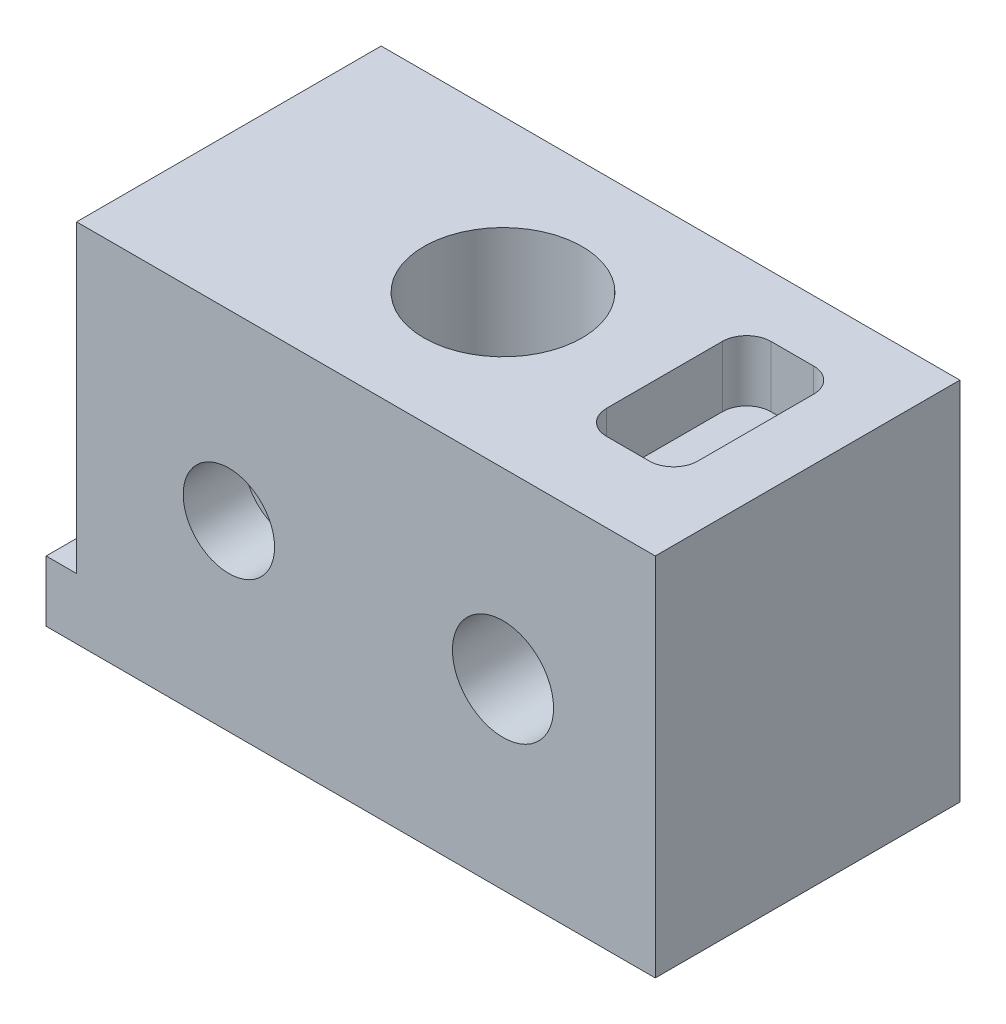
from build123d import *

# Parameters (mm, degrees)
SKETCH1_W           = 100
SKETCH1_H           = 50
BOSS_EXTRUDE1_DEPTH = 60
SKETCH2_W           = 5
SKETCH2_H           = 50
CUT_EXTRUDE1_DEPTH  = 50
SKETCH3_R           = 13
CUT_EXTRUDE2_DEPTH  = 50
SKETCH4_R           = 8.30196488
CUT_EXTRUDE3_DEPTH  = 93.736184955
CUT_EXTRUDE4_DEPTH  = 10
SKETCH7_R           = 7.5
CUT_EXTRUDE5_DEPTH  = 10


with BuildPart() as part:
    # Sketch1 → Boss-Extrude1 (new body)
    with BuildSketch(Plane(origin=(0, 0, 0), x_dir=(1, 0, 0), z_dir=(0, 1, 0))):
        Rectangle(SKETCH1_W, SKETCH1_H)
    extrude(amount=BOSS_EXTRUDE1_DEPTH)

    # Sketch2 → Cut-Extrude1 (cut)
    with BuildSketch(Plane(origin=(0, 60, 0), x_dir=(1, 0, 0), z_dir=(0, 1, 0))):
        with Locations((-47.5, 0)):
            Rectangle(SKETCH2_W, SKETCH2_H)
    extrude(amount=-CUT_EXTRUDE1_DEPTH, mode=Mode.SUBTRACT)

    # Sketch3 → Cut-Extrude2 (cut)
    with BuildSketch(Plane(origin=(0, 60, 0), x_dir=(1, 0, 0), z_dir=(0, 1, 0))):
        Circle(SKETCH3_R)
    extrude(amount=-CUT_EXTRUDE2_DEPTH, mode=Mode.SUBTRACT)

    # Sketch4 → Cut-Extrude3 (cut, through all)
    with BuildSketch(Plane.XY.offset(25)):
        with Locations((25, 30)):
            Circle(SKETCH4_R)
    extrude(amount=-CUT_EXTRUDE3_DEPTH, mode=Mode.SUBTRACT)

    # Sketch6 → Cut-Extrude4 (cut)
    with BuildSketch(Plane(origin=(0, 60, 0), x_dir=(1, 0, 0), z_dir=(0, 1, 0))):
        with BuildLine():
            Line((29, 15), (36, 15))
            ThreePointArc((36, 15), (38.828427125, 13.828427125), (40, 11))
            Line((40, 11), (40, -8))
            ThreePointArc((40, -8), (38.828427125, -10.828427125), (36, -12))
            Line((36, -12), (29, -12))
            ThreePointArc((29, -12), (26.171572875, -10.828427125), (25, -8))
            Line((25, -8), (25, 11))
            ThreePointArc((25, 11), (26.171572875, 13.828427125), (29, 15))
        make_face()
    extrude(amount=-CUT_EXTRUDE4_DEPTH, mode=Mode.SUBTRACT)

    # Sketch7 → Cut-Extrude5 (cut)
    with BuildSketch(Plane.XY.offset(25)):
        with Locations((-20, 30)):
            Circle(SKETCH7_R)
    extrude(amount=-CUT_EXTRUDE5_DEPTH, mode=Mode.SUBTRACT)


solid = part.part
